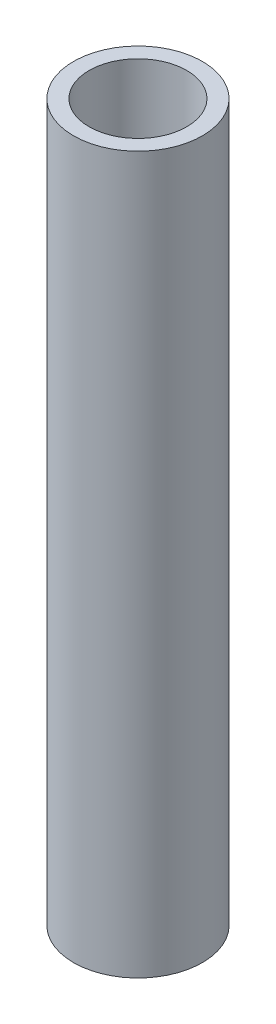
from build123d import *

# Parameters (mm, degrees)
SKETCH1_R           = 12.573
SKETCH1_R_2         = 9.525
BOSS_EXTRUDE1_DEPTH = 139.7


with BuildPart() as part:
    # Sketch1 → Boss-Extrude1 (new body)
    with BuildSketch(Plane(origin=(0, 0, 0), x_dir=(1, 0, 0), z_dir=(0, 1, 0))):
        Circle(SKETCH1_R)
        Circle(SKETCH1_R_2, mode=Mode.SUBTRACT)
    extrude(amount=BOSS_EXTRUDE1_DEPTH)


solid = part.part
